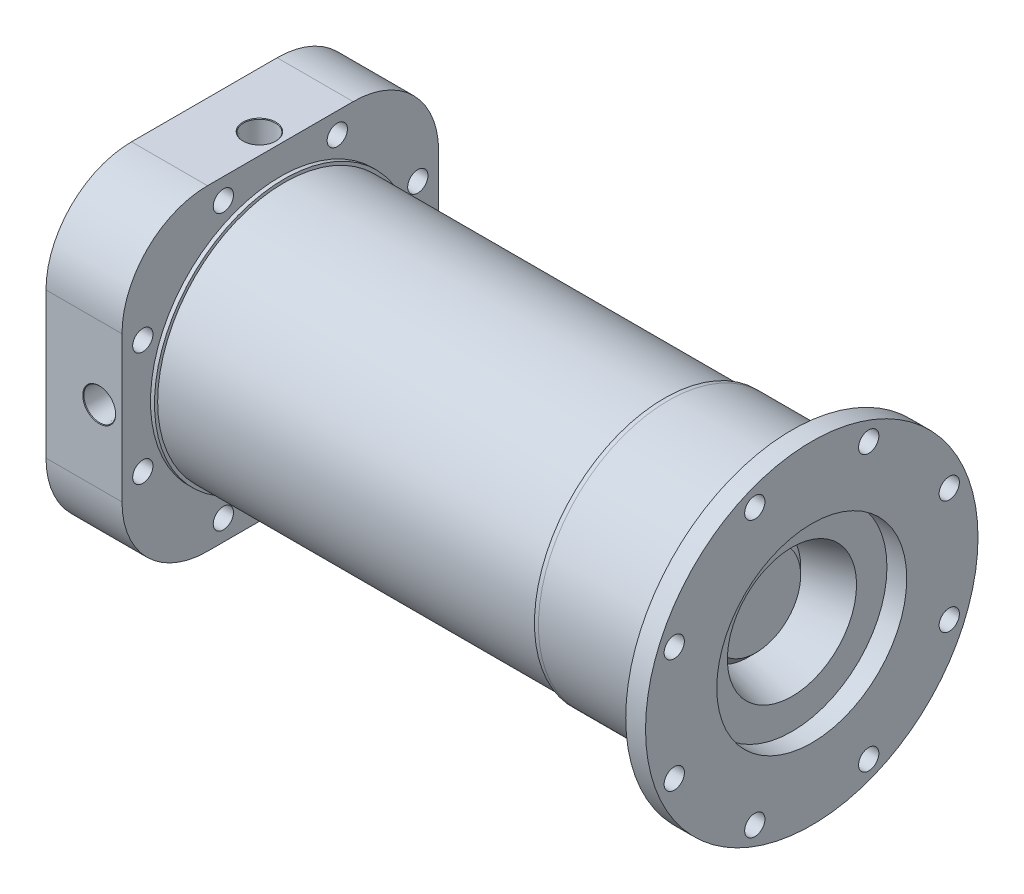
from build123d import *

# Parameters (mm, degrees)
FILLET1_R                = 1.27
CUT_EXTRUDE1_REACH       = 243.296
SKETCH2_R                = 3.81
CIRPATTERN1_COUNT        = 8
SKETCH4_R                = 63.5
BOSS_EXTRUDE1_DEPTH      = 31.75
SKETCH11_W               = 127
SKETCH11_H               = 127
BOSS_EXTRUDE2_DEPTH      = 31.75
SKETCH12_R               = 24.13
CUT_EXTRUDE4_DEPTH       = 16.51
CUT_EXTRUDE5_START       = -39.450428
SKETCH13_R               = 1.9685
CUT_EXTRUDE5_DEPTH       = 39.450428
CHAMFER1_SIZE            = 4.572
FILLET2_R                = 0.889
FILLET3_R                = 0.508
CUT_EXTRUDE9_REACH       = 267.18
CUT_EXTRUDE9_END_RADIUS  = 24.13
SKETCH31_R               = 1.5875
SKETCH37_W               = 127
SKETCH37_H               = 127
SKETCH37_R               = 43.7515
CUT_EXTRUDE12_DEPTH      = 1.27
SKETCH32_R               = 69.85
SKETCH32_R_2             = 44.45
BOSS_EXTRUDE3_DEPTH      = 1.6002
SKETCH33_R               = 50.8
SKETCH33_R_2             = 44.45
BOSS_EXTRUDE4_DEPTH      = 152.4
BOSS_EXTRUDE5_START      = 154.0002
SKETCH32_2_R             = 69.85
SKETCH32_2_R_2           = 44.45
BOSS_EXTRUDE5_DEPTH      = 1.6002
FILLET4_R                = 0.254
FILLET5_R                = 1.27
FILLET6_R                = 34.29
CUT_EXTRUDE11_DEPTH      = 227.308869564
CUT_EXTRUDE11_DEPTH_BACK = 1.6002
SKETCH36_R               = 69.85
SKETCH36_R_2             = 52.07
SKETCH39_R               = 66.675
SKETCH39_R_2             = 38.1
BOSS_EXTRUDE6_DEPTH      = 7.9375
SKETCH40_R               = 4.064
CUT_EXTRUDE13_DEPTH      = 254.853713409
CIRPATTERN3_COUNT        = 8
FILLET7_R                = 3.81


# Read off the part's stored shape, not the designer's step: Ø6.7 (6.7) Diameter Hole1
with BuildPart() as part:
    # Chamber Revolve → Revolve1 (revolve)
    with BuildSketch(Plane.XY, mode=Mode.PRIVATE) as revolve1_sk:
        with BuildLine():
            Line((223.962313951, 63.5), (223.962313951, 25.908))
            Line((223.962313951, 25.908), (191.916500941, 17.321350283))
            ThreePointArc((191.916500941, 17.321350283), (190.601700192, 17.321350283), (189.463049342, 17.978750658))
            Line((189.463049342, 17.978750658), (173.5582, 33.8836))
            Line((173.5582, 33.8836), (0, 33.8836))
            Line((0, 33.8836), (0, 42.5196))
            Line((0, 42.5196), (3.8608, 42.5196))
            Line((3.8608, 42.5196), (3.8608, 48.5902))
            Line((3.8608, 48.5902), (0, 48.5902))
            Line((0, 48.5902), (0, 63.5))
            Line((0, 63.5), (10.16, 63.5))
            Line((10.16, 63.5), (10.16, 47.5996))
            Line((10.16, 47.5996), (24.13, 47.5996))
            Line((24.13, 47.5996), (24.13, 63.5))
            Line((24.13, 63.5), (223.962313951, 63.5))
        make_face()
    revolve(revolve1_sk.sketch.rotate(Axis((0, 0, 0), (1, 0, 0)), 90), axis=Axis((0, 0, 0), (1, 0, 0)))

    # Fillet1
    fillet1_edges = [part.edges().sort_by_distance(p)[0] for p in [
        (24.13, 0, -47.5996),
        (10.16, 0, -47.5996),
    ]]
    fillet(fillet1_edges, radius=FILLET1_R)

    # Sketch2 → Cut-Extrude1 (cut, up to next)
    with BuildSketch(Plane.ZY, mode=Mode.PRIVATE) as cut_extrude1_sk1:
        with Locations((-21.773156568, 52.565049882)):
            Circle(SKETCH2_R)
    cut_extrude1_tool1 = extrude(cut_extrude1_sk1.sketch, amount=-CUT_EXTRUDE1_REACH, mode=Mode.PRIVATE) & part.part
    cut_extrude1 = cut_extrude1_tool1.solids().sort_by_distance((0, 52.56505, -21.773157))[0]
    add(cut_extrude1, mode=Mode.SUBTRACT)

    # CirPattern1: Cut-Extrude1 ×8 about axis
    cirpattern1_axis = Axis((0, 0, 0), (1, 0, 0))
    for i in range(1, CIRPATTERN1_COUNT):
        add(cut_extrude1.rotate(cirpattern1_axis, i * 360 / CIRPATTERN1_COUNT), mode=Mode.SUBTRACT)

    # Fillet2
    fillet2_edges = [part.edges().sort_by_distance(p)[0] for p in [
        (3.8608, 0, -42.5196),
        (3.8608, 0, -48.5902),
    ]]
    fillet(fillet2_edges, radius=FILLET2_R)


with BuildPart() as body_2:
    # Sketch4 → Boss-Extrude1 (new body)
    with BuildSketch(Plane.ZY):
        Circle(SKETCH4_R)
    extrude(amount=BOSS_EXTRUDE1_DEPTH)

    # Sketch11 → Boss-Extrude2 (add)
    with BuildSketch(Plane.ZY.offset(31.75)):
        Rectangle(SKETCH11_W, SKETCH11_H)
    extrude(amount=-BOSS_EXTRUDE2_DEPTH)

    # Sketch12 → Cut-Extrude4 (cut)
    with BuildSketch(Plane(origin=(0, 0, 0), x_dir=(0, 0, -1), z_dir=(1, 0, 0))):
        Circle(SKETCH12_R)
    extrude(amount=-CUT_EXTRUDE4_DEPTH, mode=Mode.SUBTRACT)

    # Sketch13 → Cut-Extrude5 (cut)
    with BuildSketch(Plane.XY.offset(63.5).offset(CUT_EXTRUDE5_START)):
        with Locations((-10.414, 0)):
            Circle(SKETCH13_R)
    cut_extrude5 = extrude(amount=CUT_EXTRUDE5_DEPTH, mode=Mode.SUBTRACT)

    # Chamfer1
    chamfer1_edges = [body_2.edges().sort_by_distance(p)[0] for p in [
        (0, 0, 24.13),
    ]]
    chamfer(chamfer1_edges, length=CHAMFER1_SIZE)

    # Sketch20 → 1/4 NPT Tapped Hole1 (revolve, cut)
    with BuildSketch(Plane(origin=(-10.414, 0, 63.5), x_dir=(0, -1, 0), z_dir=(1, 0, 0))):
        Polygon((0, 0), (0, 24.932347279), (5.5626, 21.59), (5.5626, 14.478), (5.950466326, 14.478), (6.3771653, 0.2268347), (6.604, 0), align=None)
    f_1_4_npt_tapped_hole1 = revolve(axis=Axis((-10.414, 0, 69.85), (0, 0, -1)), mode=Mode.SUBTRACT)

    # Mirror1: Cut-Extrude5, 1/4 NPT Tapped Hole1 across plane
    add(cut_extrude5.mirror(Plane.XY), mode=Mode.SUBTRACT)
    add(f_1_4_npt_tapped_hole1.mirror(Plane.XY), mode=Mode.SUBTRACT)

    # Ø6.7 (6.7) Diameter Hole1 outline → Ø6.7 (6.7) Diameter Hole1 (revolve, cut)
    with BuildSketch(Plane(origin=(0, -33.02, 0), x_dir=(0, 1, 0), z_dir=(0, 0, -1))):
        Polygon((3.35, -16.256), (0, -14.243116926), (0, -31.75), (3.75, -31.75), (3.35, -31.35), align=None)
    f_6_7_6_7_diameter_hole1 = revolve(axis=Axis((0, -33.02, 0), (1, 0, 0)), mode=Mode.SUBTRACT)

    # Mirror2: Ø6.7 (6.7) Diameter Hole1 across plane
    add(f_6_7_6_7_diameter_hole1.mirror(Plane.ZX), mode=Mode.SUBTRACT)

    # Sketch24 → Cut-Revolve1 (revolve, cut)
    with BuildSketch(Plane(origin=(0, 0, 0), x_dir=(1, 0, 0), z_dir=(0, 1, 0))):
        with BuildLine():
            Line((-31.75, 7.1374), (-30.958106371, 5.7658))
            Line((-30.958106371, 5.7658), (-29.845, 5.7658))
            ThreePointArc((-29.845, 5.7658), (-29.650596816, 5.727130803), (-29.485789755, 5.617010245))
            Line((-29.485789755, 5.617010245), (-28.73287951, 4.8641))
            Line((-28.73287951, 4.8641), (-16.51, 4.8641))
            Line((-16.51, 4.8641), (-16.51, 0))
            Line((-16.51, 0), (-31.75, 0))
            Line((-31.75, 0), (-31.75, 7.1374))
        make_face()
    revolve(axis=Axis((223.962313951, 0, 0), (-1, 0, 0)), mode=Mode.SUBTRACT)

    # Fillet3
    fillet3_edges = [body_2.edges().sort_by_distance(p)[0] for p in [
        (-30.958106371, 0, 5.7658),
    ]]
    fillet(fillet3_edges, radius=FILLET3_R)

    # Sketch30 → 1/4 NPT Tapped Hole2 (revolve, cut)
    with BuildSketch(Plane(origin=(-9.652, -63.5, 0), x_dir=(0, 0, -1), z_dir=(1, 0, 0))):
        Polygon((0, 0), (0, 24.932347279), (5.5626, 21.59), (5.5626, 14.478), (5.950466326, 14.478), (6.3771653, 0.2268347), (6.604, 0), align=None)
    f_1_4_npt_tapped_hole2 = revolve(axis=Axis((-9.652, -69.85, 0), (0, 1, 0)), mode=Mode.SUBTRACT)

    # Cut-Extrude9: up to this cylinder (the profile starts outside it)
    cut_extrude9_end = Plane(origin=(-9.652, 0, 0), z_dir=(1, 0, 0)) * Cylinder(CUT_EXTRUDE9_END_RADIUS, 583.62, mode=Mode.PRIVATE)
    # Sketch31 → Cut-Extrude9 (cut, up to the surface)
    with BuildSketch(Plane.XZ.offset(63.5), mode=Mode.PRIVATE) as cut_extrude9_sk1:
        with Locations(Location((-9.652, 0, 0), (0, 0, 270))):
            Circle(SKETCH31_R)
    cut_extrude9_tool1 = extrude(cut_extrude9_sk1.sketch, amount=-CUT_EXTRUDE9_REACH, mode=Mode.PRIVATE) - cut_extrude9_end
    cut_extrude9 = cut_extrude9_tool1.solids().sort_by_distance((-9.652, -63.5, 0))[0]
    add(cut_extrude9, mode=Mode.SUBTRACT)

    # Mirror3: 1/4 NPT Tapped Hole2, Cut-Extrude9 across plane
    add(f_1_4_npt_tapped_hole2.mirror(Plane.ZX), mode=Mode.SUBTRACT)
    add(cut_extrude9.mirror(Plane.ZX), mode=Mode.SUBTRACT)

    # Sketch37 → Cut-Extrude12 (cut)
    with BuildSketch(Plane(origin=(0, 0, 0), x_dir=(0, 0, -1), z_dir=(1, 0, 0))):
        Rectangle(SKETCH37_W, SKETCH37_H)
        Circle(SKETCH37_R, mode=Mode.SUBTRACT)
    extrude(amount=-CUT_EXTRUDE12_DEPTH, mode=Mode.SUBTRACT)

    # Fillet6
    fillet6_edges = [body_2.edges().sort_by_distance(p)[0] for p in [
        (-16.51, 63.5, 63.5),
        (-16.51, -63.5, 63.5),
        (-16.51, -63.5, -63.5),
        (-16.51, 63.5, -63.5),
    ]]
    fillet(fillet6_edges, radius=FILLET6_R)


with BuildPart() as body_3:
    # Sketch21 → Revolve2 (revolve)
    with BuildSketch(Plane(origin=(0, 0, 0), x_dir=(1, 0, 0), z_dir=(0, 1, 0))):
        Polygon((0, 33.8836), (173.5582, 33.8836), (189.463049342, 17.978750658), (189.463049342, 0), (0, 0), align=None)
    revolve(axis=Axis((189.463049342, 0, 0), (1, 0, 0)))


with BuildPart() as body_3_2:
    # Sketch32 → Boss-Extrude3 (new body)
    with BuildSketch(Plane(origin=(-1.27, 0, 0), x_dir=(0, 0, -1), z_dir=(1, 0, 0))):
        Circle(SKETCH32_R)
        Circle(SKETCH32_R_2, mode=Mode.SUBTRACT)
    extrude(amount=BOSS_EXTRUDE3_DEPTH)


with BuildPart() as body_4:
    # Sketch33 → Boss-Extrude4 (new body)
    with BuildSketch(Plane(origin=(0.3302, 0, 0), x_dir=(0, 0, -1), z_dir=(1, 0, 0))):
        with Locations(Location((0, 0, 0), (0, 0, 180))):
            Circle(SKETCH33_R)
        with Locations(Location((0, 0, 0), (0, 0, 180))):
            Circle(SKETCH33_R_2, mode=Mode.SUBTRACT)
    extrude(amount=BOSS_EXTRUDE4_DEPTH)


with BuildPart() as body_5:
    # Sketch32<2> → Boss-Extrude5 (new body)
    with BuildSketch(Plane(origin=(-1.27, 0, 0), x_dir=(0, 0, -1), z_dir=(1, 0, 0)).offset(BOSS_EXTRUDE5_START)):
        Circle(SKETCH32_2_R)
        Circle(SKETCH32_2_R_2, mode=Mode.SUBTRACT)
    extrude(amount=BOSS_EXTRUDE5_DEPTH)


with BuildPart() as body_6:
    # Sketch34 → Revolve3 (revolve)
    with BuildSketch(Plane.XY, mode=Mode.PRIVATE) as revolve3_sk:
        Polygon((154.3304, 52.07), (154.3304, 43.815), (151.7904, 43.815), (151.7904, 40.005), (154.3304, 40.005), (170.479426495, 16.9418), (203.941740446, 25.908), (203.941740446, 52.07), align=None)
    revolve(revolve3_sk.sketch.rotate(Axis((152.7302, 0, 0), (-1, 0, 0)), 90), axis=Axis((152.7302, 0, 0), (-1, 0, 0)))

    # Fillet4
    fillet4_edges = [body_6.edges().sort_by_distance(p)[0] for p in [
        (154.3304, 0, 43.815),
    ]]
    fillet(fillet4_edges, radius=FILLET4_R)

    # Fillet5
    fillet5_edges = [body_6.edges().sort_by_distance(p)[0] for p in [
        (170.479426495, 0, 16.9418),
    ]]
    fillet(fillet5_edges, radius=FILLET5_R)

    # Fillet7
    fillet7_edges = [body_6.edges().sort_by_distance(p)[0] for p in [
        (154.3304, 0, 40.005),
    ]]
    fillet(fillet7_edges, radius=FILLET7_R)


with BuildPart() as cut_extrude11_tool:
    # Sketch36 → Cut-Extrude11 (new, two sides: drawn at the far end of the back side and taken through both)
    with BuildSketch(Plane(origin=(0.3302, 0, 0), x_dir=(0, 0, -1), z_dir=(1, 0, 0)).offset(-CUT_EXTRUDE11_DEPTH_BACK)):
        Circle(SKETCH36_R)
        Circle(SKETCH36_R_2, mode=Mode.SUBTRACT)
    extrude(amount=CUT_EXTRUDE11_DEPTH + CUT_EXTRUDE11_DEPTH_BACK)


with BuildPart() as body_3_2_1:
    add(body_3_2.part)

    # Cut-Extrude11: cut by cut_extrude11_tool
    add(cut_extrude11_tool.part, mode=Mode.SUBTRACT)


with BuildPart() as body_5_1:
    add(body_5.part)

    # Cut-Extrude11: cut by cut_extrude11_tool
    add(cut_extrude11_tool.part, mode=Mode.SUBTRACT)


with BuildPart() as body_7:
    # Sketch39 → Boss-Extrude6 (new body)
    with BuildSketch(Plane(origin=(203.941740446, 0, 0), x_dir=(0, 0, -1), z_dir=(1, 0, 0))):
        Circle(SKETCH39_R)
        Circle(SKETCH39_R_2, mode=Mode.SUBTRACT)
    extrude(amount=BOSS_EXTRUDE6_DEPTH)


with BuildPart() as cut_extrude13_tool:
    # Sketch40 → Cut-Extrude13 (new, symmetric)
    with BuildSketch(Plane.ZY.offset(-203.941740446)):
        with Locations(Location((-22.842374078, 55.146369296, 0), (0, 0, 180))):
            Circle(SKETCH40_R)
    cut_extrude13 = extrude(amount=CUT_EXTRUDE13_DEPTH, both=True)


with BuildPart() as body_2_1:
    add(body_2.part)

    # Cut-Extrude13: cut by cut_extrude13_tool
    add(cut_extrude13_tool.part, mode=Mode.SUBTRACT)


with BuildPart() as body_7_1:
    add(body_7.part)

    # Cut-Extrude13: cut by cut_extrude13_tool
    add(cut_extrude13_tool.part, mode=Mode.SUBTRACT)


with BuildPart() as cirpattern3_tool:
    # CirPattern3: Cut-Extrude13 ×8 about axis
    cirpattern3_axis = Axis((0, 0, 0), (1, 0, 0))
    for i in range(1, CIRPATTERN3_COUNT):
        add(cut_extrude13.rotate(cirpattern3_axis, i * 360 / CIRPATTERN3_COUNT))


with BuildPart() as body_2_2:
    add(body_2_1.part)

    # CirPattern3: cut by cirpattern3_tool
    add(cirpattern3_tool.part, mode=Mode.SUBTRACT)


with BuildPart() as body_7_2:
    add(body_7_1.part)

    # CirPattern3: cut by cirpattern3_tool
    add(cirpattern3_tool.part, mode=Mode.SUBTRACT)


solid = Compound([body_3.part, body_4.part, body_6.part, body_3_2_1.part, body_5_1.part, body_2_2.part, body_7_2.part])
